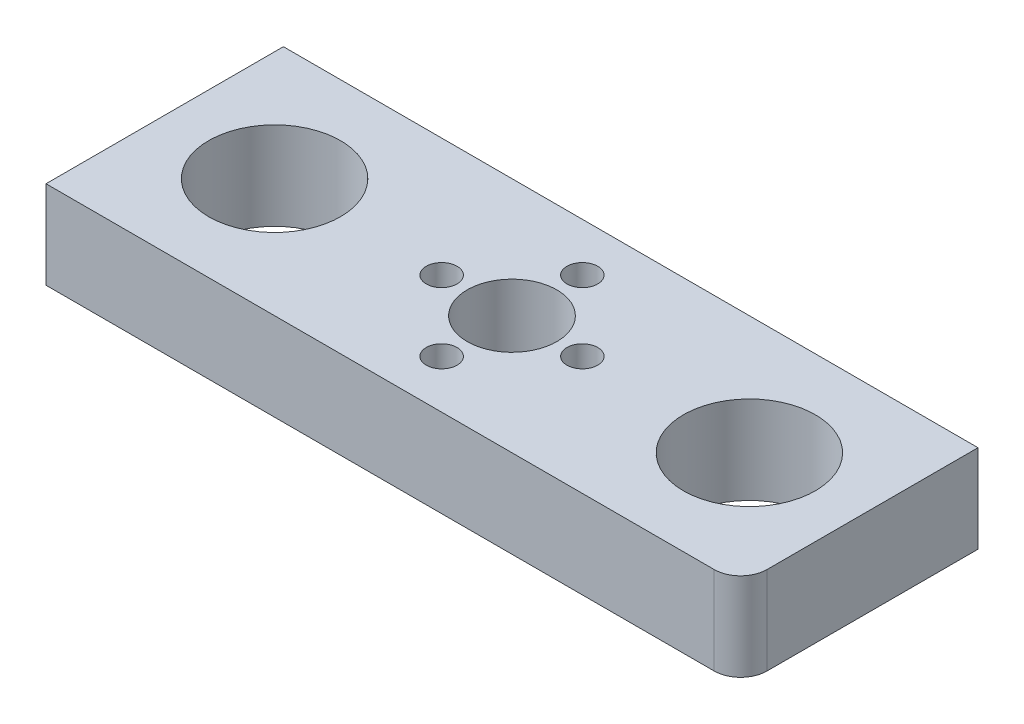
from build123d import *

# Parameters (mm, degrees)
SKETCH_1_W          = 79
SKETCH_1_H          = 27
EXTRUDE_1_DEPTH     = 10
SKETCH_3_R          = 7.5
CUT_EXTRUDE_1_DEPTH = 43.924352063
FILLET_1_R          = 3
SKETCH_4_R          = 5.1
CUT_EXTRUDE_2_DEPTH = 43.924352063
SKETCH_5_R          = 1.75
CUT_EXTRUDE_3_DEPTH = 43.924352063


with BuildPart() as part:
    # 草图1 → 凸台-拉伸1 (new body)
    with BuildSketch(Plane(origin=(0, 0, 0), x_dir=(1, 0, 0), z_dir=(0, 1, 0))):
        Rectangle(SKETCH_1_W, SKETCH_1_H)
    extrude(amount=EXTRUDE_1_DEPTH)

    # 草图3 → 切除-拉伸1 (cut, through all)
    with BuildSketch(Plane(origin=(0, 10, 0), x_dir=(1, 0, 0), z_dir=(0, 1, 0))):
        with Locations((-27, 0)):
            Circle(SKETCH_3_R)
        with Locations((27, 0)):
            Circle(SKETCH_3_R)
    extrude(amount=-CUT_EXTRUDE_1_DEPTH, mode=Mode.SUBTRACT)

    # 圆角1
    fillet_1_edges = [part.edges().sort_by_distance(p)[0] for p in [
        (39.5, 5, 13.5),
    ]]
    fillet(fillet_1_edges, radius=FILLET_1_R)

    # 草图4 → 切除-拉伸2 (cut, through all)
    with BuildSketch(Plane(origin=(0, 10, 0), x_dir=(1, 0, 0), z_dir=(0, 1, 0))):
        Circle(SKETCH_4_R)
    extrude(amount=-CUT_EXTRUDE_2_DEPTH, mode=Mode.SUBTRACT)

    # 草图5 → 切除-拉伸3 (cut, through all)
    with BuildSketch(Plane(origin=(0, 10, 0), x_dir=(1, 0, 0), z_dir=(0, 1, 0))):
        with Locations((8, 0)):
            Circle(SKETCH_5_R)
        with Locations((0, -8)):
            Circle(SKETCH_5_R)
        with Locations((-8, 0)):
            Circle(SKETCH_5_R)
        with Locations((0, 8)):
            Circle(SKETCH_5_R)
    extrude(amount=-CUT_EXTRUDE_3_DEPTH, mode=Mode.SUBTRACT)


solid = part.part
